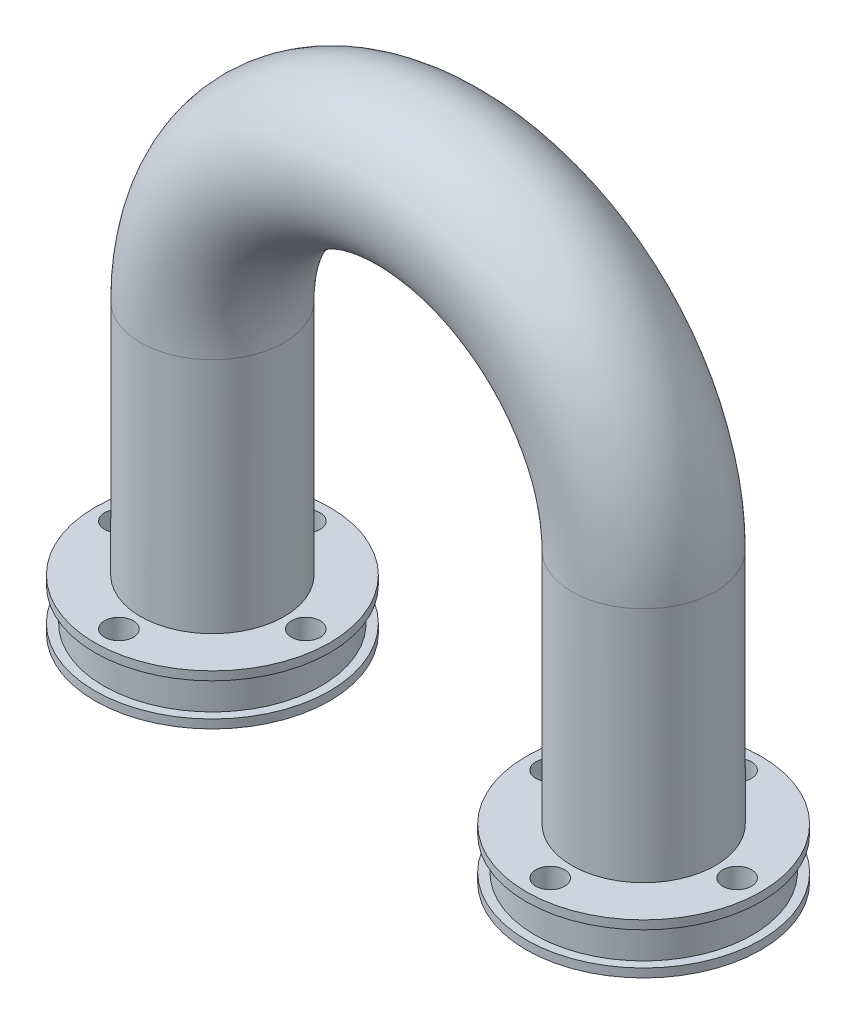
from build123d import *

# Parameters (mm, degrees)
SKETCH2_R          = 10
SHELL1_T           = -4
SKETCH8_R          = 2
CUT_EXTRUDE2_DEPTH = 10


with BuildPart() as part:
    # Sweep1: sweep along a path in Sketch1
    with BuildLine(Plane.XY) as sweep1_path:
        Line((-30, -33), (-30, 0))
        ThreePointArc((-30, 0), (0, 30), (30, 0))
        Line((30, 0), (30, -33))
    # Sketch2 → Sweep1 (sweep)
    with BuildSketch(Plane(origin=(-30, -33, 0), x_dir=(-1, 0, 0), z_dir=(0, -1, 0))):
        Circle(SKETCH2_R)
    sweep(path=sweep1_path.line)

    # Shell1
    shell1_openings = [part.faces().sort_by_distance(p)[0] for p in [
        (30, -33, 0),
        (-30, -33, 0),
    ]]
    offset(amount=SHELL1_T, openings=shell1_openings, kind=Kind.INTERSECTION)

    # Sketch6 → Revolve1 (revolve)
    with BuildSketch(Plane.XY):
        Polygon((-36, -33), (-36, -40), (-46.330583968, -40), (-46.330583968, -38.8), (-45.130583968, -38.8), (-45.130583968, -34.2), (-46.330583968, -34.2), (-46.330583968, -33), align=None)
    revolve1 = revolve(axis=Axis((-30, -33, 0), (0, 1, 0)))

    # Sketch8 → Cut-Extrude2 (cut, symmetric)
    with BuildSketch(Plane(origin=(-30, -33, 0), x_dir=(-1, 0, 0), z_dir=(0, -1, 0))):
        with Locations((0, -13)):
            Circle(SKETCH8_R)
        with Locations((-13, 0)):
            Circle(SKETCH8_R)
        with Locations((0, 13)):
            Circle(SKETCH8_R)
        with Locations((13, 0)):
            Circle(SKETCH8_R)
    cut_extrude2 = extrude(amount=CUT_EXTRUDE2_DEPTH, both=True, mode=Mode.SUBTRACT)

    # Mirror3: Revolve1, Cut-Extrude2 across plane
    add(revolve1.mirror(Plane(origin=(0, 0, 0), x_dir=(0, 0, 1), z_dir=(1, 0, 0))))
    add(cut_extrude2.mirror(Plane(origin=(0, 0, 0), x_dir=(0, 0, 1), z_dir=(1, 0, 0))), mode=Mode.SUBTRACT)


solid = part.part
